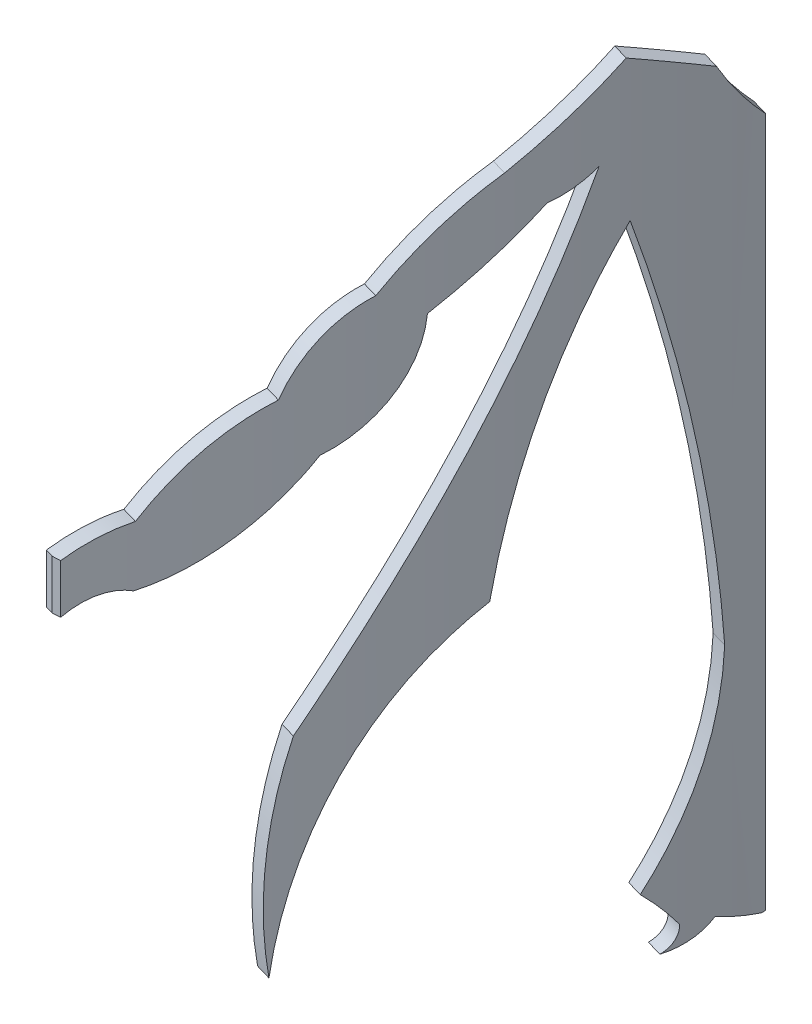
from build123d import *

# Parameters (mm, degrees)
BASE_FLANGE1_DEPTH = 152.4
CUT_EXTRUDE2_DEPTH = 210.453765781
SKETCH8_OUTSIDE_W  = 91.669
SKETCH8_OUTSIDE_H  = 186.952
CUT_EXTRUDE3_DEPTH = 156.159268245
CUT_EXTRUDE5_DEPTH = 150.529804304
CUT_EXTRUDE6_DEPTH = 150.529804304


# Sheet-metal steps are written as plain solids
with BuildPart() as part:
    # Sketch1 → Base-Flange1 (new body)
    with BuildSketch(Plane(origin=(0, 0, 0), x_dir=(1, 0, 0), z_dir=(0, 1, 0))):
        with BuildLine():
            ThreePointArc((101.6, 0), (0, 101.6), (-101.6, 0))
            Line((-101.6, 0), (-100.076, 0))
            ThreePointArc((-100.076, 0), (0, 100.076), (100.076, 0))
            Line((100.076, 0), (101.6, 0))
        make_face()
    extrude(amount=BASE_FLANGE1_DEPTH)

    # Sketch7 → Cut-Extrude2 (cut, through all)
    with BuildSketch(Plane(origin=(0, 0, 0), x_dir=(1, 0, 0), z_dir=(0, 1, 0))):
        Polygon((-91.709043777, 57.490350595), (138.01260718, -58.815220223), (145.858691999, 79.364012989), (-90.642426647, 185.885465098), align=None)
    extrude(amount=CUT_EXTRUDE2_DEPTH, mode=Mode.SUBTRACT)

    # Sketch8 outside → Cut-Extrude3 (cut, through all)
    with BuildSketch(Plane(origin=(-92.234633035, 0, -26.893225996), x_dir=(-0.27991806035793976, 0, 0.9600238952679506), z_dir=(-0.9600238952679506, 0, -0.27991806035793976))):
        with Locations((-0.1185, 76.2)):
            Rectangle(SKETCH8_OUTSIDE_W, SKETCH8_OUTSIDE_H)
        with BuildLine():
            Line((28.228420724, 123.255255295), (28.228420724, 63.013426534))
            Line((28.228420724, 63.013426534), (-23.710305665, 67.943144138))
            Line((-23.710305665, 67.943144138), (-24.773491826, 75.417539706))
            Line((-24.773491826, 75.417539706), (-24.773491826, 140.385814226))
            ThreePointArc((-24.773491826, 140.385814226), (-22.985555805, 142.451644443), (-21.54666964, 144.774137995))
            Line((-21.54666964, 144.774137995), (-15.477635794, 146.793089403))
            ThreePointArc((-15.477635794, 146.793089403), (-11.468978559, 143.067294692), (-6.985554285, 139.928857844))
            ThreePointArc((-6.985554285, 139.928857844), (-2.02114191, 136.922848828), (2.45774455, 133.232177276))
            ThreePointArc((2.45774455, 133.232177276), (6.806375414, 131.32724859), (9.926241691, 127.748732402))
            ThreePointArc((9.926241691, 127.748732402), (16.039086335, 126.228175305), (21.554569405, 123.185411754))
            ThreePointArc((21.554569405, 123.185411754), (24.888843169, 123.473733589), (28.228420724, 123.255255295))
        make_face(mode=Mode.SUBTRACT)
    extrude(amount=CUT_EXTRUDE3_DEPTH, mode=Mode.SUBTRACT)

    # Sketch9 → Cut-Extrude5 (cut, through all)
    with BuildSketch(Plane(origin=(-92.234633035, 0, -26.893225996), x_dir=(-0.27991806035793976, 0, 0.9600238952679506), z_dir=(-0.9600238952679506, 0, -0.27991806035793976))):
        with BuildLine():
            Line((-24.501828907, 76.777557676), (-27.569176237, 78.5320759))
            Line((-27.569176237, 78.5320759), (-29.494089624, 68.863518536))
            Line((-29.494089624, 68.863518536), (-21.26675398, 50.764523355))
            Line((-21.26675398, 50.764523355), (28.228420724, 57.34408301))
            Line((28.228420724, 57.34408301), (28.013079808, 118.763565618))
            ThreePointArc((28.013079808, 118.763565618), (24.75429403, 118.880140281), (21.705230571, 117.724075223))
            ThreePointArc((21.705230571, 117.724075223), (13.693303318, 118.137203319), (6.704304858, 122.076182077))
            ThreePointArc((6.704304858, 122.076182077), (1.166010219, 124.850428459), (-1.395339362, 130.490343247))
            ThreePointArc((-1.395339362, 130.490343247), (-5.917319527, 133.265505392), (-9.991337743, 136.664358893))
            ThreePointArc((-9.991337743, 136.664358893), (-11.942393165, 137.4181864), (-13.626649766, 138.658409311))
            ThreePointArc((-13.626649766, 138.658409311), (-4.330180004, 118.477783543), (8.758521079, 100.523176602))
            ThreePointArc((8.758521079, 100.523176602), (10.931974112, 91.396763407), (10.672272602, 82.018710783))
            ThreePointArc((10.672272602, 82.018710783), (5.176812074, 95.990549965), (-5.917317854, 106.106510507))
            ThreePointArc((-5.917317854, 106.106510507), (-9.582838682, 120.389201142), (-15.747934485, 133.784084063))
            ThreePointArc((-15.747934485, 133.784084063), (-20.011123577, 116.370294996), (-22.090885373, 98.563290146))
            ThreePointArc((-22.090885373, 98.563290146), (-20.494324779, 88.872234651), (-16.433576157, 79.929311026))
            ThreePointArc((-16.433576157, 79.929311026), (-17.84229029, 78.509895577), (-19.097539053, 76.953114838))
            ThreePointArc((-19.097539053, 76.953114838), (-18.740022488, 75.714547524), (-17.763603379, 74.872839255))
            ThreePointArc((-17.763603379, 74.872839255), (-19.832219816, 75.585249002), (-21.44191431, 77.066999739))
            ThreePointArc((-21.44191431, 77.066999739), (-22.961230073, 76.809778861), (-24.501828907, 76.777557676))
        make_face()
    extrude(amount=CUT_EXTRUDE5_DEPTH, mode=Mode.SUBTRACT)

    # Sketch10 → Cut-Extrude6 (cut, through all)
    with BuildSketch(Plane(origin=(-92.234633035, 0, -26.893225996), x_dir=(-0.27991806035793976, 0, 0.9600238952679506), z_dir=(-0.9600238952679506, 0, -0.27991806035793976))):
        Polygon((28.013079808, 118.763565618), (28.728121694, 118.655926759), (28.728121694, 52.453532496), (22.818416534, 52.453532496), (26.943491202, 118.763565618), align=None)
    extrude(amount=CUT_EXTRUDE6_DEPTH, mode=Mode.SUBTRACT)


solid = part.part
